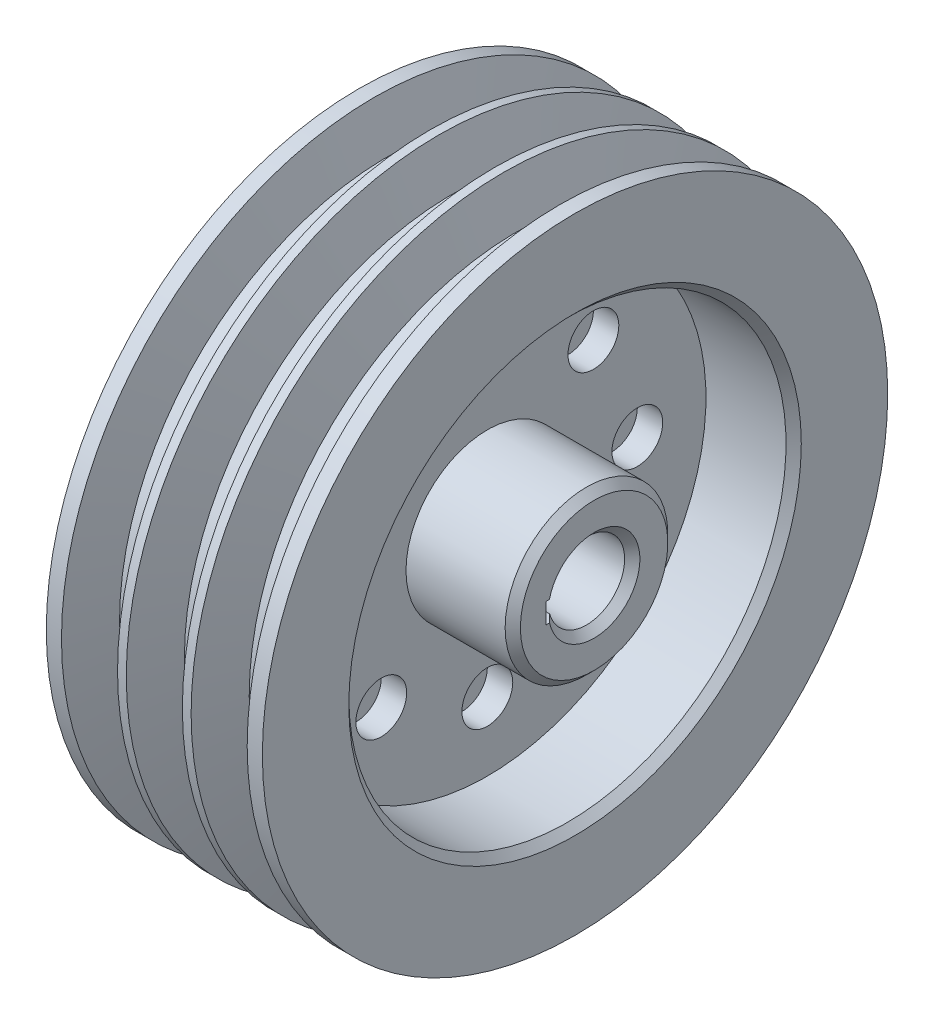
from build123d import *

# Parameters (mm, degrees)
OTHER_START              = -2
OTHER_1_OUTLINE_R        = 10
OTHER_1_DEPTH            = 10
CUT_EXTRUDE_1_DEPTH      = 181.991712517
CUT_EXTRUDE_1_DEPTH_BACK = 181.991712517
SKETCH_4_W               = 24.82633163
SKETCH_4_H               = 8


# Read off the part's stored shape, not the designer's step: 孔1
with BuildPart() as part:
    # 草图1 → 旋转9 (revolve)
    with BuildSketch(Plane.XY, mode=Mode.PRIVATE) as revolve_9_sk:
        Polygon((-47, 15), (47, 15), (50, 18), (50, 29), (47, 32), (8, 32), (8, 86), (39.5, 86), (42.5, 89), (42.5, 123), (36.528653407, 123), (31.178366482, 105.5), (19.821633518, 105.5), (14.471346593, 123), (11.028653407, 123), (5.678366482, 105.5), (-5.678366482, 105.5), (-11.028653407, 123), (-14.471346593, 123), (-19.821633518, 105.5), (-31.178366482, 105.5), (-36.528653407, 123), (-42.5, 123), (-42.5, 89), (-39.5, 86), (-8, 86), (-8, 32), (-47, 32), (-50, 29), (-50, 18), align=None)
    revolve(revolve_9_sk.sketch.rotate(Axis((-111.724769182, 0, 0), (1, 0, 0)), 90), axis=Axis((-111.724769182, 0, 0), (1, 0, 0)))

    # 孔1 outline → 孔1 (cut)
    with BuildSketch(Plane.YZ.offset(OTHER_START)):
        with Locations((0, -59)):
            Circle(OTHER_1_OUTLINE_R)
        with Locations((-41.71930009, -41.71930009)):
            Circle(OTHER_1_OUTLINE_R)
        with Locations((-59, 0)):
            Circle(OTHER_1_OUTLINE_R)
        with Locations((-41.71930009, 41.71930009)):
            Circle(OTHER_1_OUTLINE_R)
        with Locations((0, 59)):
            Circle(OTHER_1_OUTLINE_R)
        with Locations((41.71930009, 41.71930009)):
            Circle(OTHER_1_OUTLINE_R)
        with Locations((59, 0)):
            Circle(OTHER_1_OUTLINE_R)
        with Locations((41.71930009, -41.71930009)):
            Circle(OTHER_1_OUTLINE_R)
    extrude(amount=OTHER_1_DEPTH, mode=Mode.SUBTRACT)

    # 草图4 → 切除-拉伸1 (cut, two sides: drawn at the far end of the back side and taken through both)
    with BuildSketch(Plane(origin=(0, 0, 0), x_dir=(0, 0, -1), z_dir=(1, 0, 0)).offset(-CUT_EXTRUDE_1_DEPTH_BACK)):
        with Locations((-6.586834185, 0)):
            Rectangle(SKETCH_4_W, SKETCH_4_H)
    extrude(amount=CUT_EXTRUDE_1_DEPTH + CUT_EXTRUDE_1_DEPTH_BACK, mode=Mode.SUBTRACT)


solid = part.part
